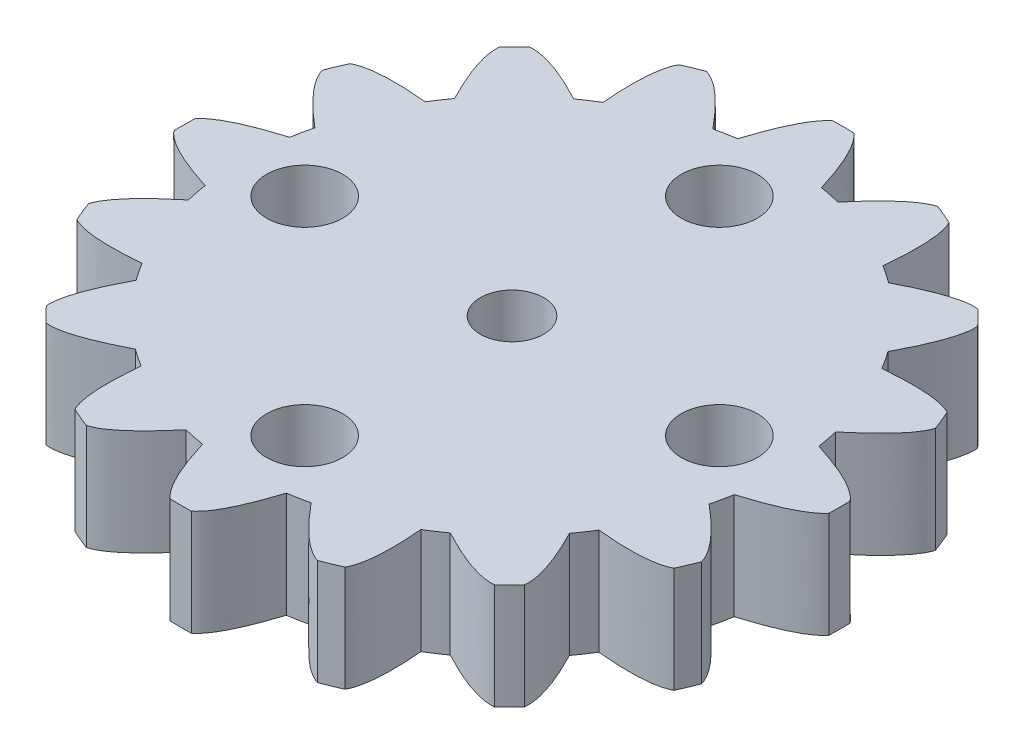
from build123d import *

# Parameters (mm, degrees)
BOSS_EXTRUDE4_DEPTH = 5
CIRPATTERN6_COUNT   = 16
SKETCH2_R           = 1.5
CUT_EXTRUDE1_DEPTH  = 10
SKETCH5_R           = 1.8
CUT_EXTRUDE2_DEPTH  = 10
CIRPATTERN7_COUNT   = 4


with BuildPart() as part:
    # Sketch1 → Boss-Extrude4 (new body)
    with BuildSketch(Plane(origin=(0, 0, 0), x_dir=(1, 0, 0), z_dir=(0, 1, 0))):
        with BuildLine():
            ThreePointArc((11.422555102, 10.588944735), (11.076748025, 10.950167526), (10.719523409, 11.300103253))
            add(Edge.make_bspline(
                [(10.719523409, 11.300103253), (9.768180921, 11.408474051), (7.542984157, 10.257547652)],
                knots=[0.625515525, 0.625515525, 0.625515525, 1, 1, 1], degree=2))
            ThreePointArc((7.542984157, 10.257547652), (-9.054751485, -8.951277527), (10.34356078, 7.424597242))
            add(Edge.make_bspline(
                [(10.34356078, 7.424597242), (11.519985079, 9.636419587), (11.422555102, 10.588944735)],
                knots=[0, 0, 0, 0.374484475, 0.374484475, 0.374484475], degree=2))
        make_face()
    boss_extrude4 = extrude(amount=BOSS_EXTRUDE4_DEPTH)

    # CirPattern6: Boss-Extrude4 ×16 about axis
    cirpattern6_axis = Axis((0, 5, 0), (0, 1, 0))
    for i in range(1, CIRPATTERN6_COUNT):
        add(boss_extrude4.rotate(cirpattern6_axis, i * 360 / CIRPATTERN6_COUNT))

    # Sketch2 → Cut-Extrude1 (cut)
    with BuildSketch(Plane(origin=(0, 5, 0), x_dir=(1, 0, 0), z_dir=(0, 1, 0))):
        Circle(SKETCH2_R)
    extrude(amount=-CUT_EXTRUDE1_DEPTH, mode=Mode.SUBTRACT)

    # Sketch5 → Cut-Extrude2 (cut)
    with BuildSketch(Plane(origin=(0, 5, 0), x_dir=(1, 0, 0), z_dir=(0, 1, 0))):
        with Locations((9.8, 0)):
            Circle(SKETCH5_R)
    cut_extrude2 = extrude(amount=-CUT_EXTRUDE2_DEPTH, mode=Mode.SUBTRACT)

    # CirPattern7: Cut-Extrude2 ×4 about axis
    cirpattern7_axis = Axis((0, 5, 0), (0, 1, 0))
    for i in range(1, CIRPATTERN7_COUNT):
        add(cut_extrude2.rotate(cirpattern7_axis, i * 360 / CIRPATTERN7_COUNT), mode=Mode.SUBTRACT)


solid = part.part
